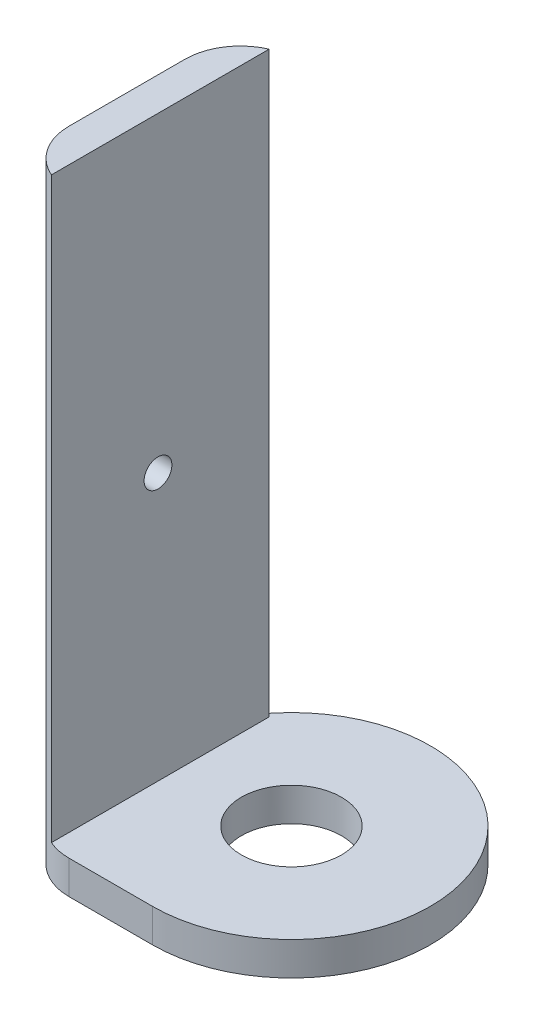
from build123d import *

# Parameters (mm, degrees)
BOSS_EXTRUDE1_DEPTH         = 3
SKETCH1_4_W                 = 3
SKETCH1_4_H                 = 20
BOSS_EXTRUDE3_DEPTH         = 55
M8_CLEARANCE_HOLE1_D        = 9
TAP_DRILL_FOR_M3X0_5_TAP1_D = 2.5
FILLET1_R                   = 5


with BuildPart() as part:
    # Sketch1 → Boss-Extrude1 (new body)
    with BuildSketch(Plane(origin=(0, 0, 0), x_dir=(1, 0, 0), z_dir=(0, 1, 0))):
        with BuildLine():
            Line((-12.5, -12.5), (0, -12.5))
            ThreePointArc((0, -12.5), (11.180339887, 5.590169944), (-10, 7.5))
            Line((-10, 7.5), (-12.5, 7.5))
            Line((-12.5, 7.5), (-12.5, -12.5))
        make_face()
    extrude(amount=BOSS_EXTRUDE1_DEPTH)

    # Sketch1<4> → Boss-Extrude3 (add)
    with BuildSketch(Plane(origin=(0, 0, 0), x_dir=(1, 0, 0), z_dir=(0, 1, 0))):
        with Locations((-11, -2.5)):
            Rectangle(SKETCH1_4_W, SKETCH1_4_H)
    extrude(amount=BOSS_EXTRUDE3_DEPTH)

    # M8 Clearance Hole1 (through all)
    with Locations(Plane(origin=(0, 0, 0), x_dir=(-1, 0, 0), z_dir=(0, -1, 0))):
        with Locations((0, 0)):
            Hole(M8_CLEARANCE_HOLE1_D / 2)

    # Tap Drill for M3x0.5 Tap1 (through all)
    with Locations(Plane.ZY.offset(12.5)):
        with Locations((2.5, 27)):
            Hole(TAP_DRILL_FOR_M3X0_5_TAP1_D / 2)

    # Fillet1
    # the kernel refuses this fillet: 5 mm, written as the material it takes off along each edge
    with BuildSketch(Plane(origin=(-12.5, -12.5, 12.5), x_dir=(0, 0, -1), z_dir=(0, 1, 0))) as fillet1_piece_1:
        with BuildLine():
            CenterArc((FILLET1_R, -FILLET1_R), FILLET1_R, 90, 90)
            Line((0, -FILLET1_R), (0, 0))
            Line((0, 0), (FILLET1_R, 0))
        make_face()
    extrude(amount=80, mode=Mode.SUBTRACT)
    with BuildSketch(Plane(origin=(-12.5, -11.456439237, -7.5), x_dir=(1, 0, 0), z_dir=(0, 1, 0))) as fillet1_piece_2_section:
        with BuildLine():
            CenterArc((5, -4.582575695), FILLET1_R, 113.578178478, 66.421821522)
            Line((0, -4.582575695), (0, 0))
            Line((0, 0), (3, 0))
        make_face()
    fillet1_piece_2 = extrude(amount=77.912878475, mode=Mode.PRIVATE)
    fillet1_piece_2 = fillet1_piece_2 - Plane(origin=(0, -11.456439237, 0), x_dir=(0, 0, 1), z_dir=(0, -1, 0)) * Cylinder(12.5, 175, mode=Mode.PRIVATE)
    add(fillet1_piece_2, mode=Mode.SUBTRACT)
    with BuildSketch(Plane(origin=(-12.5, -11.456439237, -7.5), x_dir=(1, 0, 0), z_dir=(0, 1, 0))) as fillet1_piece_3_section:
        with BuildLine():
            CenterArc((5, -4.582575695), FILLET1_R, 113.578178478, 66.421821522)
            Line((0, -4.582575695), (0, 0))
            Line((0, 0), (3, 0))
        make_face()
    fillet1_piece_3 = extrude(amount=77.912878475, mode=Mode.PRIVATE)
    fillet1_piece_3 = split(fillet1_piece_3, bisect_by=Plane(origin=(-12.5, 3, -7.5), z_dir=(0, 1, 0)), keep=Keep.TOP, mode=Mode.PRIVATE)
    add(fillet1_piece_3, mode=Mode.SUBTRACT)


solid = part.part
